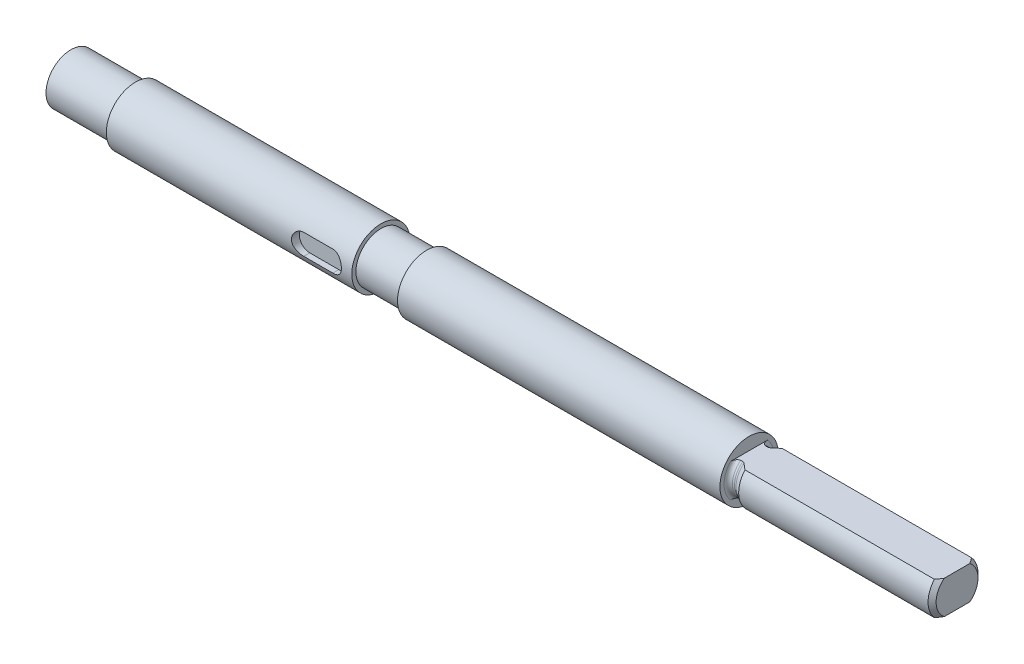
from build123d import *

# Parameters (mm, degrees)
SCHNITT_LINEAR_AUSTRAGEN1_DEPTH      = 143.352054199
SCHNITT_LINEAR_AUSTRAGEN1_DEPTH_BACK = 143.352054199
SKIZZE4_W                            = 80.01116069
SKIZZE4_H                            = 4.996766738
SCHNITT_LINEAR_AUSTRAGEN2_DEPTH      = 143.867446828
SCHNITT_LINEAR_AUSTRAGEN2_DEPTH_BACK = 1.9


# Read off the part's stored shape, not the designer's step: M12 Maschinengewinde Bolzen1
with BuildPart() as part:
    # Skizze2 → Rotation1 (revolve)
    with BuildSketch(Plane.XY, mode=Mode.PRIVATE) as rotation1_sk:
        Polygon((-70.992580001, 0), (-70.992580001, 6), (-55.492580001, 6), (-55.492580001, 7), (3.507419999, 7), (3.507419999, 6), (14.507419999, 6), (14.507419999, 7), (92.007419999, 7), (92.007419999, 6), (142.007419999, 6), (142.007419999, 0), align=None)
    revolve(rotation1_sk.sketch.rotate(Axis((-31.289719626, 0, 0), (1, 0, 0)), 90), axis=Axis((-31.289719626, 0, 0), (1, 0, 0)))

    # M12 Maschinengewinde Bolzen1 outline → M12 Maschinengewinde Bolzen1 (revolve, cut)
    with BuildSketch(Plane.YX):
        with BuildLine():
            Line((6, 95.507419999), (5.133974596, 94.007419999))
            ThreePointArc((5.133974596, 94.007419999), (5.034074174, 93.766239044), (5, 93.507419999))
            Line((5, 93.507419999), (5, 93.007419999))
            ThreePointArc((5, 93.007419999), (5.292893219, 92.300313218), (6, 92.007419999))
            Line((6, 92.007419999), (6, 95.507419999))
        make_face()
        Polygon((5.036, 142.007419999), (6, 141.043419999), (6, 142.007419999), align=None)
    revolve(axis=Axis((0, 0, 0), (1, 0, 0)), mode=Mode.SUBTRACT)

    # Skizze4 → Schnitt-Linear austragen1 (cut, two sides: drawn at the far end of the back side and taken through both)
    with BuildSketch(Plane.XY.offset(-SCHNITT_LINEAR_AUSTRAGEN1_DEPTH_BACK)):
        with Locations((132.013000344, 6.498383369)):
            Rectangle(SKIZZE4_W, SKIZZE4_H)
        with Locations((132.013000344, -6.498383369)):
            Rectangle(SKIZZE4_W, SKIZZE4_H)
    extrude(amount=SCHNITT_LINEAR_AUSTRAGEN1_DEPTH + SCHNITT_LINEAR_AUSTRAGEN1_DEPTH_BACK, mode=Mode.SUBTRACT)

    # Skizze5 → Schnitt-Linear austragen2 (cut, two sides: drawn at the far end of the back side and taken through both)
    with BuildSketch(Plane.XY.offset(7).offset(-SCHNITT_LINEAR_AUSTRAGEN2_DEPTH_BACK)):
        with BuildLine():
            Line((-1.492580001, -2.5), (-8.492580001, -2.5))
            ThreePointArc((-8.492580001, -2.5), (-10.992580001, 0), (-8.492580001, 2.5))
            Line((-8.492580001, 2.5), (-1.492580001, 2.5))
            ThreePointArc((-1.492580001, 2.5), (1.007419999, 0), (-1.492580001, -2.5))
        make_face()
    extrude(amount=SCHNITT_LINEAR_AUSTRAGEN2_DEPTH + SCHNITT_LINEAR_AUSTRAGEN2_DEPTH_BACK, mode=Mode.SUBTRACT)


solid = part.part
